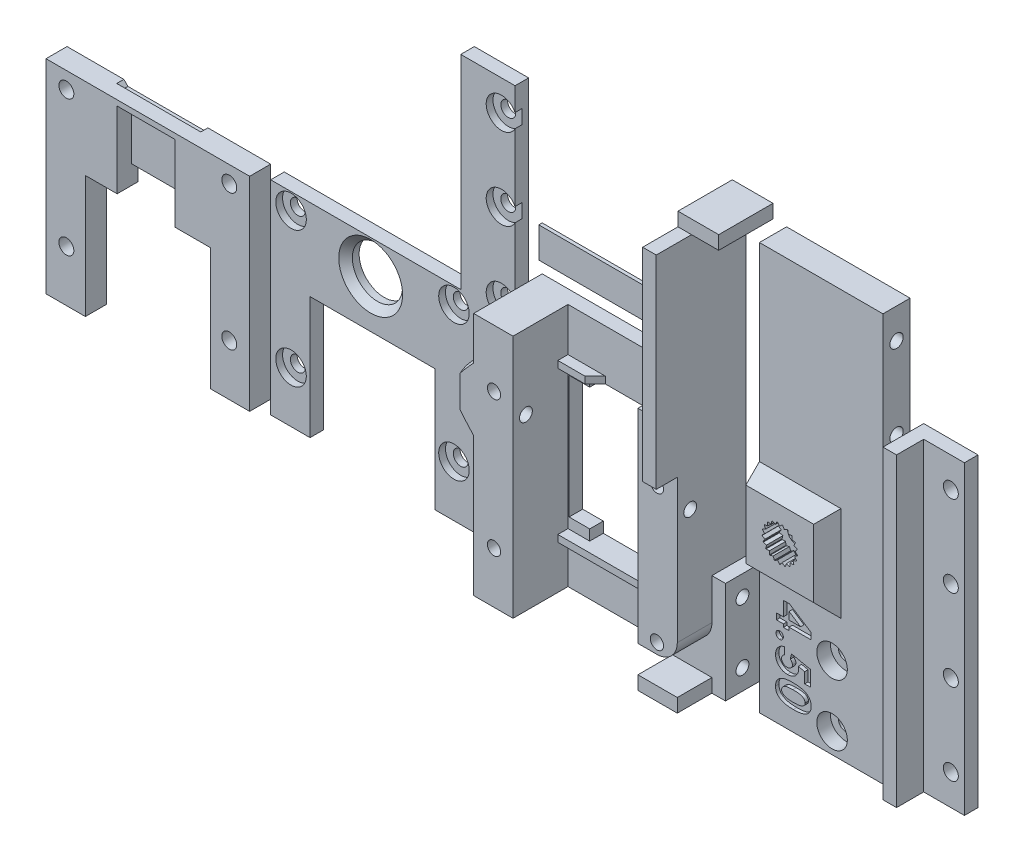
from build123d import *

# Parameters (mm, degrees)
SKETCH2_W                 = 30
SKETCH2_H                 = 36
SKETCH2_W_2               = 18.08
SKETCH2_H_2               = 18.08
BOSS_EXTRUDE1_DEPTH       = 2
SKETCH4_W                 = 5.8
SKETCH4_H                 = 36
BOSS_EXTRUDE2_DEPTH       = 8.1
SKETCH35_W                = 5.8
SKETCH35_H                = 4
CUT_EXTRUDE17_DEPTH       = 5.1
SKETCH14_W                = 12
SKETCH14_H                = 21.2
CUT_EXTRUDE6_DEPTH        = 25.791329129
SKETCH52_W                = 4
SKETCH52_H                = 1
SKETCH52_W_2              = 18.4
BOSS_EXTRUDE27_DEPTH      = 1.5
CHAMFER6_SIZE             = 1.5
SKETCH5_W                 = 30
SKETCH5_H                 = 12
BOSS_EXTRUDE3_DEPTH       = 1
SKETCH6_W                 = 10.48
SKETCH6_H                 = 12
SKETCH6_W_2               = 11.02
BOSS_EXTRUDE4_DEPTH       = 2.1
SKETCH49_W                = 8.5
SKETCH49_H                = 2
CUT_EXTRUDE19_DEPTH       = 1
CHAMFER5_SIZE             = 0.8
SKETCH23_W                = 5.8
SKETCH23_H                = 18
BOSS_EXTRUDE10_DEPTH      = 3.1
SKETCH7_W                 = 8.5
SKETCH7_H                 = 0.8
BOSS_EXTRUDE5_DEPTH       = 2.1
SKETCH10_W                = 11.18
SKETCH10_H                = 0.45
CUT_EXTRUDE2_DEPTH        = 0.6
SKETCH9_W                 = 30
SKETCH9_H                 = 12
SKETCH9_R                 = 3.7
BOSS_EXTRUDE6_DEPTH       = 2
CHAMFER1_SIZE             = 0.6
SKETCH24_W                = 5.8
SKETCH24_H                = 18
BOSS_EXTRUDE11_DEPTH      = 2
SKETCH30_W                = 2
SKETCH30_H                = 15
BOSS_EXTRUDE13_DEPTH      = 5
BOSS_EXTRUDE8_DEPTH       = 13.2
BOSS_EXTRUDE8_DEPTH_BACK  = 5
SKETCH16_W                = 4
SKETCH16_H                = 60
SKETCH32_R                = 0.95
CUT_EXTRUDE14_DEPTH       = 10.8
SKETCH33_R                = 1.05
CUT_EXTRUDE15_DEPTH       = 4
SKETCH34_R                = 2.25
CUT_EXTRUDE16_DEPTH       = 2
SKETCH19_W                = 2
SKETCH19_H                = 60
BOSS_EXTRUDE9_DEPTH       = 6
SKETCH41_W                = 2
SKETCH41_H                = 10.1
BOSS_EXTRUDE17_DEPTH      = 24
SKETCH45_W                = 2
SKETCH45_H                = 30
BOSS_EXTRUDE21_DEPTH      = 2
SKETCH44_W                = 2
SKETCH44_H                = 29.9
BOSS_EXTRUDE20_DEPTH      = 3.1
SKETCH11_R                = 0.975
CUT_EXTRUDE3_DEPTH        = 52.11790293
CUT_EXTRUDE4_START        = -5.1
SKETCH12_R                = 1.1
CUT_EXTRUDE4_DEPTH        = 5.1
SKETCH13_R                = 2.25
CUT_EXTRUDE5_DEPTH        = 1
LPATTERN4_COUNT           = 2
LPATTERN4_PITCH           = 20
LPATTERN4_COPY_1_SKETCH_R = 0.975
LPATTERN4_COPY_1_DEPTH    = 52.11790293
LPATTERN4_START           = -5.1
LPATTERN4_COPY_2_SKETCH_R = 1.1
LPATTERN4_COPY_2_DEPTH    = 5.1
LPATTERN4_COPY_3_SKETCH_R = 2.25
LPATTERN4_COPY_3_DEPTH    = 1
SKETCH42_W                = 8
SKETCH42_H                = 45
BOSS_EXTRUDE18_DEPTH      = 2
SKETCH43_W                = 2
SKETCH43_H                = 45
BOSS_EXTRUDE19_DEPTH      = 4
SKETCH20_R                = 0.975
CUT_EXTRUDE7_DEPTH        = 52.940735459
SKETCH21_R                = 1.1
CUT_EXTRUDE8_DEPTH        = 52.940735459
SKETCH22_R                = 2.25
CUT_EXTRUDE9_DEPTH        = 1
SKETCH50_W                = 6
SKETCH50_H                = 8
BOSS_EXTRUDE25_DEPTH      = 2
LPATTERN6_COUNT           = 5
LPATTERN6_PITCH           = 12
LPATTERN7_COUNT           = 5
LPATTERN7_PITCH           = 12
SKETCH26_W                = 10
SKETCH26_H                = 10
BOSS_EXTRUDE12_DEPTH      = 2
CUT_EXTRUDE11_START       = 2
SKETCH25_R                = 2.625
CUT_EXTRUDE11_DEPTH       = 2.4
BOSS_EXTRUDE28_DEPTH      = 2.4
CIRPATTERN1_COUNT         = 21
SKETCH28_R                = 1.25
CUT_EXTRUDE12_DEPTH       = 3.6
SKETCH29_R                = 3
CUT_EXTRUDE13_DEPTH       = 1.8
SKETCH51_W                = 5.454356058
SKETCH51_H                = 1.75
BOSS_EXTRUDE26_DEPTH      = 0.2
CHAMFER2_SIZE             = 1
FILLET1_R                 = 3
SKETCH37_W                = 2
SKETCH37_H                = 6
BOSS_EXTRUDE14_DEPTH      = 10.1
SKETCH53_OUTSIDE_W        = 39.61
SKETCH53_OUTSIDE_H        = 79.41
SKETCH53_OUTSIDE_R        = 3
CUT_EXTRUDE20_DEPTH       = 2
SKETCH36_R                = 0.95
CUT_EXTRUDE18_DEPTH       = 62.376216892
CHAMFER4_SIZE             = 2
BOSS_EXTRUDE15_START      = 3.25
SKETCH38_W                = 18.08
SKETCH38_H                = 4.5
BOSS_EXTRUDE15_DEPTH      = 0.5
CHAMFER3_SIZE             = 2
CUT_EXTRUDE21_START       = 4
CUT_EXTRUDE21_DEPTH       = 0.5
BODY_MOVE_COPY3_ANGLE     = 90


with BuildPart() as part:
    # Sketch2 → Boss-Extrude1 (new body)
    with BuildSketch(Plane.XY):
        Rectangle(SKETCH2_W, SKETCH2_H)
        Rectangle(SKETCH2_W_2, SKETCH2_H_2, mode=Mode.SUBTRACT)
    extrude(amount=BOSS_EXTRUDE1_DEPTH)

    # Sketch4 → Boss-Extrude2 (add)
    with BuildSketch(Plane.XY.offset(2)):
        with Locations((-12.1, 0)):
            Rectangle(SKETCH4_W, SKETCH4_H)
        with Locations((12.1, 0)):
            Rectangle(SKETCH4_W, SKETCH4_H)
    extrude(amount=BOSS_EXTRUDE2_DEPTH)

    # Sketch35 → Cut-Extrude17 (cut)
    with BuildSketch(Plane.XY.offset(10.1)):
        with Locations((12.1, -14)):
            Rectangle(SKETCH35_W, SKETCH35_H)
    extrude(amount=-CUT_EXTRUDE17_DEPTH, mode=Mode.SUBTRACT)

    # Sketch14 → Cut-Extrude6 (cut, through all)
    with BuildSketch(Plane.XY.offset(2)):
        Rectangle(SKETCH14_W, SKETCH14_H)
    extrude(amount=-CUT_EXTRUDE6_DEPTH, mode=Mode.SUBTRACT)

    # Sketch52 → Boss-Extrude27 (add)
    with BuildSketch(Plane.XY.offset(2)):
        with Locations((-7.2, 11.1)):
            Rectangle(SKETCH52_W, SKETCH52_H)
        with Locations((7.2, 11.1)):
            Rectangle(SKETCH52_W, SKETCH52_H)
        with Locations((0, -11.1)):
            Rectangle(SKETCH52_W_2, SKETCH52_H)
    extrude(amount=BOSS_EXTRUDE27_DEPTH)

    # Chamfer6
    chamfer6_edges = [part.edges().sort_by_distance(p)[0] for p in [
        (5.2, 11.1, 2),
        (-5.2, 11.1, 2),
    ]]
    chamfer(chamfer6_edges, length=CHAMFER6_SIZE - 0.0001)  # a hair under: the kernel refuses the full size

    # Sketch30 → Boss-Extrude13 (add)
    with BuildSketch(Plane.XY):
        with Locations((16, -10.5)):
            Rectangle(SKETCH30_W, SKETCH30_H)
    extrude(amount=BOSS_EXTRUDE13_DEPTH)


with BuildPart() as body_2:
    # Sketch5 → Boss-Extrude3 (new body)
    with BuildSketch(Plane.XY.offset(10.1)):
        with Locations((0, 6)):
            Rectangle(SKETCH5_W, SKETCH5_H)
    extrude(amount=BOSS_EXTRUDE3_DEPTH)

    # Sketch6 → Boss-Extrude4 (add)
    with BuildSketch(Plane.XY.offset(11.1)):
        with Locations((-9.76, 6)):
            Rectangle(SKETCH6_W, SKETCH6_H)
        with Locations((9.49, 6)):
            Rectangle(SKETCH6_W_2, SKETCH6_H)
    extrude(amount=BOSS_EXTRUDE4_DEPTH)

    # Sketch49 → Cut-Extrude19 (cut)
    with BuildSketch(Plane.XY.offset(11.1)):
        with Locations((-0.27, 1)):
            Rectangle(SKETCH49_W, SKETCH49_H)
    extrude(amount=-CUT_EXTRUDE19_DEPTH, mode=Mode.SUBTRACT)

    # Chamfer5
    chamfer5_edges = [body_2.edges().sort_by_distance(p)[0] for p in [
        (-0.27, 2, 11.1),
    ]]
    chamfer(chamfer5_edges, length=CHAMFER5_SIZE)

    # Sketch23 → Boss-Extrude10 (add)
    with BuildSketch(Plane.XY.offset(10.1)):
        with Locations((-12.1, -9)):
            Rectangle(SKETCH23_W, SKETCH23_H)
        with Locations((12.1, -9)):
            Rectangle(SKETCH23_W, SKETCH23_H)
    extrude(amount=BOSS_EXTRUDE10_DEPTH)

    # Sketch7 → Boss-Extrude5 (add)
    with BuildSketch(Plane.XY.offset(11.1)):
        with Locations((-0.27, 11.6)):
            Rectangle(SKETCH7_W, SKETCH7_H)
    extrude(amount=BOSS_EXTRUDE5_DEPTH)

    # Sketch10 → Cut-Extrude2 (cut)
    with BuildSketch(Plane(origin=(0, 12, 0), x_dir=(1, 0, 0), z_dir=(0, 1, 0))):
        with Locations((-0.44, -10.325)):
            Rectangle(SKETCH10_W, SKETCH10_H)
    extrude(amount=-CUT_EXTRUDE2_DEPTH, mode=Mode.SUBTRACT)

    # Chamfer1
    chamfer1_edges = [body_2.edges().sort_by_distance(p)[0] for p in [
        (-0.44, 12, 10.55),
        (5.15, 12, 10.325),
        (-6.03, 12, 10.325),
    ]]
    chamfer(chamfer1_edges, length=CHAMFER1_SIZE - 0.0001)  # a hair under: the kernel refuses the full size


with BuildPart() as body_3:
    # Sketch9 → Boss-Extrude6 (new body)
    with BuildSketch(Plane.XY.offset(13.2)):
        with Locations((0, 6)):
            Rectangle(SKETCH9_W, SKETCH9_H)
        with Locations((-0.27, 7.05)):
            Circle(SKETCH9_R, mode=Mode.SUBTRACT)
    extrude(amount=BOSS_EXTRUDE6_DEPTH)

    # Sketch24 → Boss-Extrude11 (add)
    with BuildSketch(Plane.XY.offset(13.2)):
        with Locations((-12.1, -9)):
            Rectangle(SKETCH24_W, SKETCH24_H)
        with Locations((12.1, -9)):
            Rectangle(SKETCH24_W, SKETCH24_H)
    extrude(amount=BOSS_EXTRUDE11_DEPTH)

    # Sketch19 → Boss-Extrude9 (add)
    with BuildSketch(Plane(origin=(15, 0, 0), x_dir=(0, 0, -1), z_dir=(1, 0, 0))):
        with Locations((-14.2, 12)):
            Rectangle(SKETCH19_W, SKETCH19_H)
    extrude(amount=BOSS_EXTRUDE9_DEPTH)

    # Sketch45 → Boss-Extrude21 (add)
    with BuildSketch(Plane.ZY.offset(-15)):
        with Locations((14.2, 27)):
            Rectangle(SKETCH45_W, SKETCH45_H)
    extrude(amount=BOSS_EXTRUDE21_DEPTH)


with BuildPart() as body_4:
    # Sketch16 → Boss-Extrude8 (new, two sides: drawn at the far end of the back side and taken through both)
    with BuildSketch(Plane.XY.offset(-BOSS_EXTRUDE8_DEPTH_BACK)):
        with Locations((19, 12)):
            Rectangle(SKETCH16_W, SKETCH16_H)
    extrude(amount=BOSS_EXTRUDE8_DEPTH + BOSS_EXTRUDE8_DEPTH_BACK)


with BuildPart() as cut_extrude14_tool:
    # Sketch32 → Cut-Extrude14 (new body)
    with BuildSketch(Plane(origin=(21, 0, 0), x_dir=(0, 0, -1), z_dir=(1, 0, 0))):
        with Locations((-2.5, -15)):
            Circle(SKETCH32_R)
        with Locations((-2.5, -6)):
            Circle(SKETCH32_R)
    extrude(amount=-CUT_EXTRUDE14_DEPTH)


with BuildPart() as part_1:
    add(part.part)

    # Cut-Extrude14: cut by cut_extrude14_tool
    add(cut_extrude14_tool.part, mode=Mode.SUBTRACT)

    # Sketch41 → Boss-Extrude17 (add)
    with BuildSketch(Plane(origin=(0, 18, 0), x_dir=(1, 0, 0), z_dir=(0, 1, 0))):
        with Locations((14, -5.05)):
            Rectangle(SKETCH41_W, SKETCH41_H)
    extrude(amount=BOSS_EXTRUDE17_DEPTH)

    # Sketch44 → Boss-Extrude20 (add)
    with BuildSketch(Plane.XY.offset(10.1)):
        with Locations((14, 27.05)):
            Rectangle(SKETCH44_W, SKETCH44_H)
    extrude(amount=BOSS_EXTRUDE20_DEPTH)


with BuildPart() as body_4_1:
    add(body_4.part)

    # Cut-Extrude14: cut by cut_extrude14_tool
    add(cut_extrude14_tool.part, mode=Mode.SUBTRACT)

    # Sketch33 → Cut-Extrude15 (cut)
    with BuildSketch(Plane(origin=(21, 0, 0), x_dir=(0, 0, -1), z_dir=(1, 0, 0))):
        with Locations((-2.5, -6)):
            Circle(SKETCH33_R)
        with Locations((-2.5, -15)):
            Circle(SKETCH33_R)
    extrude(amount=-CUT_EXTRUDE15_DEPTH, mode=Mode.SUBTRACT)

    # Sketch34 → Cut-Extrude16 (cut)
    with BuildSketch(Plane(origin=(21, 0, 0), x_dir=(0, 0, -1), z_dir=(1, 0, 0))):
        with Locations((-2.5, -6)):
            Circle(SKETCH34_R)
        with Locations((-2.5, -15)):
            Circle(SKETCH34_R)
    extrude(amount=-CUT_EXTRUDE16_DEPTH, mode=Mode.SUBTRACT)


with BuildPart() as cut_extrude3_tool:
    # Sketch11 → Cut-Extrude3 (new, through all)
    with BuildSketch(Plane.XY.offset(15.2)):
        with Locations((-12, 9.55)):
            Circle(SKETCH11_R)
    cut_extrude3 = extrude(amount=-CUT_EXTRUDE3_DEPTH)


with BuildPart() as part_2:
    add(part_1.part)

    # Cut-Extrude3: cut by cut_extrude3_tool
    add(cut_extrude3_tool.part, mode=Mode.SUBTRACT)


with BuildPart() as body_2_1:
    add(body_2.part)

    # Cut-Extrude3: cut by cut_extrude3_tool
    add(cut_extrude3_tool.part, mode=Mode.SUBTRACT)


with BuildPart() as body_3_1:
    add(body_3.part)

    # Cut-Extrude3: cut by cut_extrude3_tool
    add(cut_extrude3_tool.part, mode=Mode.SUBTRACT)


with BuildPart() as cut_extrude4_tool:
    # Sketch12 → Cut-Extrude4 (new body)
    with BuildSketch(Plane.XY.offset(15.2).offset(CUT_EXTRUDE4_START)):
        with Locations((-12, 9.55)):
            Circle(SKETCH12_R)
    cut_extrude4 = extrude(amount=CUT_EXTRUDE4_DEPTH)


with BuildPart() as body_2_2:
    add(body_2_1.part)

    # Cut-Extrude4: cut by cut_extrude4_tool
    add(cut_extrude4_tool.part, mode=Mode.SUBTRACT)


with BuildPart() as body_3_2:
    add(body_3_1.part)

    # Cut-Extrude4: cut by cut_extrude4_tool
    add(cut_extrude4_tool.part, mode=Mode.SUBTRACT)

    # Sketch13 → Cut-Extrude5 (cut)
    with BuildSketch(Plane.XY.offset(15.2)):
        with Locations((-12, 9.55)):
            Circle(SKETCH13_R)
    cut_extrude5 = extrude(amount=-CUT_EXTRUDE5_DEPTH, mode=Mode.SUBTRACT)


with BuildPart() as mirror1_tool:
    # Mirror1: Cut-Extrude3, Cut-Extrude4, Cut-Extrude5 across plane
    add(cut_extrude3.mirror(Plane(origin=(0, 0, 0), x_dir=(0, 0, 1), z_dir=(1, 0, 0))))
    add(cut_extrude4.mirror(Plane(origin=(0, 0, 0), x_dir=(0, 0, 1), z_dir=(1, 0, 0))))
    add(cut_extrude5.mirror(Plane(origin=(0, 0, 0), x_dir=(0, 0, 1), z_dir=(1, 0, 0))))


with BuildPart() as part_3:
    add(part_2.part)

    # Mirror1: cut by mirror1_tool
    add(mirror1_tool.part, mode=Mode.SUBTRACT)


with BuildPart() as body_2_3:
    add(body_2_2.part)

    # Mirror1: cut by mirror1_tool
    add(mirror1_tool.part, mode=Mode.SUBTRACT)


with BuildPart() as body_3_3:
    add(body_3_2.part)

    # Mirror1: cut by mirror1_tool
    add(mirror1_tool.part, mode=Mode.SUBTRACT)


with BuildPart() as lpattern4_tool:
    # LPattern4: Cut-Extrude3, Cut-Extrude4, Cut-Extrude5 ×2
    with Locations(*[(0, -i * LPATTERN4_PITCH, 0) for i in range(1, LPATTERN4_COUNT)]):
        add(cut_extrude3)
        add(cut_extrude4)
        add(cut_extrude5)


with BuildPart() as part_4:
    add(part_3.part)

    # LPattern4: cut by lpattern4_tool
    add(lpattern4_tool.part, mode=Mode.SUBTRACT)


with BuildPart() as body_2_4:
    add(body_2_3.part)

    # LPattern4: cut by lpattern4_tool
    add(lpattern4_tool.part, mode=Mode.SUBTRACT)


with BuildPart() as body_3_4:
    add(body_3_3.part)

    # LPattern4: cut by lpattern4_tool
    add(lpattern4_tool.part, mode=Mode.SUBTRACT)


with BuildPart() as lpattern4_copy_1_tool:
    # LPattern4 copy 1 sketch → LPattern4 copy 1 (new, through all)
    with BuildSketch(Plane(origin=(0, -20, 15.2), x_dir=(-1, 0, 0), z_dir=(0, 0, 1))):
        with Locations((-12, -9.55)):
            Circle(LPATTERN4_COPY_1_SKETCH_R)
    extrude(amount=-LPATTERN4_COPY_1_DEPTH)


with BuildPart() as part_5:
    add(part_4.part)

    # LPattern4 copy 1: cut by lpattern4_copy_1_tool
    add(lpattern4_copy_1_tool.part, mode=Mode.SUBTRACT)

    # Sketch50 → Boss-Extrude25 (add)
    with BuildSketch(Plane(origin=(0, 42, 0), x_dir=(1, 0, 0), z_dir=(0, 1, 0))):
        with Locations((16, -4)):
            Rectangle(SKETCH50_W, SKETCH50_H)
    extrude(amount=BOSS_EXTRUDE25_DEPTH)

    # Fillet1
    fillet1_edges = [part_5.edges().sort_by_distance(p)[0] for p in [
        (15, -12, 7.55),
    ]]
    fillet(fillet1_edges, radius=FILLET1_R)

    # Sketch37 → Boss-Extrude14 (add)
    with BuildSketch(Plane.XY):
        with Locations((-16, 7.05)):
            Rectangle(SKETCH37_W, SKETCH37_H)
    extrude(amount=BOSS_EXTRUDE14_DEPTH)

    # Sketch53 outside → Cut-Extrude20 (cut)
    with BuildSketch(Plane.ZY.offset(17)):
        with Locations((4.1, 13)):
            Rectangle(SKETCH53_OUTSIDE_W, SKETCH53_OUTSIDE_H)
        with Locations((8.2, 7.05)):
            Circle(SKETCH53_OUTSIDE_R, mode=Mode.SUBTRACT)
    extrude(amount=-CUT_EXTRUDE20_DEPTH, mode=Mode.SUBTRACT)

    # Sketch36 → Cut-Extrude18 (cut, through all)
    with BuildSketch(Plane.ZY.offset(17)):
        with Locations((8.2, 7.05)):
            Circle(SKETCH36_R)
    extrude(amount=-CUT_EXTRUDE18_DEPTH, mode=Mode.SUBTRACT)

    # Chamfer4
    chamfer4_edges = [part_5.edges().sort_by_distance(p)[0] for p in [
        (-15, 7.05, 5.2),
    ]]
    chamfer(chamfer4_edges, length=CHAMFER4_SIZE - 0.0001)  # a hair under: the kernel refuses the full size


with BuildPart() as body_2_5:
    add(body_2_4.part)

    # LPattern4 copy 1: cut by lpattern4_copy_1_tool
    add(lpattern4_copy_1_tool.part, mode=Mode.SUBTRACT)


with BuildPart() as body_3_5:
    add(body_3_4.part)

    # LPattern4 copy 1: cut by lpattern4_copy_1_tool
    add(lpattern4_copy_1_tool.part, mode=Mode.SUBTRACT)


with BuildPart() as lpattern4_copy_2_tool:
    # LPattern4 copy 2 sketch → LPattern4 copy 2 (new body)
    with BuildSketch(Plane(origin=(0, -20, 15.2), x_dir=(-1, 0, 0), z_dir=(0, 0, 1)).offset(LPATTERN4_START)):
        with Locations((-12, -9.55)):
            Circle(LPATTERN4_COPY_2_SKETCH_R)
    extrude(amount=LPATTERN4_COPY_2_DEPTH)


with BuildPart() as body_2_6:
    add(body_2_5.part)

    # LPattern4 copy 2: cut by lpattern4_copy_2_tool
    add(lpattern4_copy_2_tool.part, mode=Mode.SUBTRACT)


with BuildPart() as body_3_6:
    add(body_3_5.part)

    # LPattern4 copy 2: cut by lpattern4_copy_2_tool
    add(lpattern4_copy_2_tool.part, mode=Mode.SUBTRACT)

    # LPattern4 copy 3 sketch → LPattern4 copy 3 (cut)
    with BuildSketch(Plane(origin=(0, -20, 15.2), x_dir=(-1, 0, 0), z_dir=(0, 0, 1))):
        with Locations((-12, -9.55)):
            Circle(LPATTERN4_COPY_3_SKETCH_R)
    extrude(amount=-LPATTERN4_COPY_3_DEPTH, mode=Mode.SUBTRACT)


with BuildPart() as body_5:
    # Sketch42 → Boss-Extrude18 (new body)
    with BuildSketch(Plane(origin=(0, 0, -5), x_dir=(-1, 0, 0), z_dir=(0, 0, -1))):
        with Locations((-17, 19.5)):
            Rectangle(SKETCH42_W, SKETCH42_H)
    extrude(amount=BOSS_EXTRUDE18_DEPTH)

    # Sketch43 → Boss-Extrude19 (add)
    with BuildSketch(Plane.XY.offset(-5)):
        with Locations((14, 19.5)):
            Rectangle(SKETCH43_W, SKETCH43_H)
    extrude(amount=BOSS_EXTRUDE19_DEPTH)


with BuildPart() as cut_extrude7_tool:
    # Sketch20 → Cut-Extrude7 (new, through all)
    with BuildSketch(Plane.XY.offset(15.2)):
        with Locations((19, -10.45)):
            Circle(SKETCH20_R)
    cut_extrude7 = extrude(amount=-CUT_EXTRUDE7_DEPTH)


with BuildPart() as body_3_7:
    add(body_3_6.part)

    # Cut-Extrude7: cut by cut_extrude7_tool
    add(cut_extrude7_tool.part, mode=Mode.SUBTRACT)

    # Sketch21 → Cut-Extrude8 (cut, through all)
    with BuildSketch(Plane.XY.offset(15.2)):
        with Locations((19, -10.45)):
            Circle(SKETCH21_R)
    cut_extrude8 = extrude(amount=-CUT_EXTRUDE8_DEPTH, mode=Mode.SUBTRACT)

    # Sketch22 → Cut-Extrude9 (cut)
    with BuildSketch(Plane.XY.offset(15.2)):
        with Locations((19, -10.45)):
            Circle(SKETCH22_R)
    cut_extrude9 = extrude(amount=-CUT_EXTRUDE9_DEPTH, mode=Mode.SUBTRACT)


with BuildPart() as body_4_2:
    add(body_4_1.part)

    # Cut-Extrude7: cut by cut_extrude7_tool
    add(cut_extrude7_tool.part, mode=Mode.SUBTRACT)

    # LPattern7: Cut-Extrude7 ×5
    with Locations(*[(0, i * LPATTERN7_PITCH, 0) for i in range(1, LPATTERN7_COUNT)]):
        add(cut_extrude7, mode=Mode.SUBTRACT)

    # Sketch26 → Boss-Extrude12 (add)
    with BuildSketch(Plane(origin=(21, 0, 0), x_dir=(0, 0, -1), z_dir=(1, 0, 0))):
        with Locations((-8.2, 7.05)):
            Rectangle(SKETCH26_W, SKETCH26_H)
    extrude(amount=BOSS_EXTRUDE12_DEPTH)

    # Sketch25 → Cut-Extrude11 (cut)
    with BuildSketch(Plane(origin=(21, 0, 0), x_dir=(0, 0, -1), z_dir=(1, 0, 0)).offset(CUT_EXTRUDE11_START)):
        with Locations(Location((-8.2, 7.05, 0), (0, 0, 180))):
            Circle(SKETCH25_R)
    extrude(amount=-CUT_EXTRUDE11_DEPTH, mode=Mode.SUBTRACT)

    # Sketch54 → Boss-Extrude28 (add)
    with BuildSketch(Plane(origin=(20.6, 0, 0), x_dir=(0, 0, -1), z_dir=(1, 0, 0))):
        with BuildLine():
            Line((-8.557226017, 9.650579661), (-8.2, 9.3))
            Line((-8.2, 9.3), (-7.842773983, 9.650579661))
            ThreePointArc((-7.842773983, 9.650579661), (-8.2, 9.675), (-8.557226017, 9.650579661))
        make_face()
    boss_extrude28 = extrude(amount=BOSS_EXTRUDE28_DEPTH)

    # CirPattern1: Boss-Extrude28 ×21 about axis
    cirpattern1_axis = Axis((0, 7.05, 8.2), (1, 0, 0))
    for i in range(1, CIRPATTERN1_COUNT):
        add(boss_extrude28.rotate(cirpattern1_axis, i * 360 / CIRPATTERN1_COUNT))

    # Sketch28 → Cut-Extrude12 (cut)
    with BuildSketch(Plane(origin=(20.6, 0, 0), x_dir=(0, 0, -1), z_dir=(1, 0, 0))):
        with Locations((-8.2, 7.05)):
            Circle(SKETCH28_R)
    extrude(amount=-CUT_EXTRUDE12_DEPTH, mode=Mode.SUBTRACT)

    # Sketch29 → Cut-Extrude13 (cut)
    with BuildSketch(Plane.ZY.offset(-17)):
        with Locations((8.2, 7.05)):
            Circle(SKETCH29_R)
    extrude(amount=-CUT_EXTRUDE13_DEPTH, mode=Mode.SUBTRACT)

    # Sketch51 → Boss-Extrude26 (add)
    with BuildSketch(Plane.ZY.offset(-18.8)):
        with Locations((8.2, 9.175)):
            Rectangle(SKETCH51_W, SKETCH51_H)
        with Locations((8.2, 4.925)):
            Rectangle(SKETCH51_W, SKETCH51_H)
    extrude(amount=BOSS_EXTRUDE26_DEPTH)

    # Chamfer3
    chamfer3_edges = [body_4_2.edges().sort_by_distance(p)[0] for p in [
        (21, 2.05, 8.2),
        (21, 7.05, 3.2),
        (21, 12.05, 8.2),
    ]]
    chamfer(chamfer3_edges, length=CHAMFER3_SIZE - 0.0001)  # a hair under: the kernel refuses the full size

    # Sketch55 → Cut-Extrude21 (cut)
    # profile 1 of 4: a face of its own
    with BuildSketch(Plane(origin=(17, 0, 0), x_dir=(0, 0, -1), z_dir=(1, 0, 0)).offset(CUT_EXTRUDE21_START)):
        Polygon((-5.571794872, -3.95724701), (-5.571794872, -4.891742203), (-8.841025641, -4.891742203), (-8.841025641, -5.340460151), (-9.674358974, -5.340460151), (-9.674358974, -4.891742203), (-10.7, -4.891742203), (-10.7, -3.994306305), (-9.674358974, -3.994306305), (-9.674358974, -1.87892169), (-8.765905449, -1.87892169), align=None)
        Polygon((-8.841025641, -3.994306305), (-7.139302885, -3.994306305), (-8.841025641, -2.887535472), align=None, mode=Mode.SUBTRACT)
    # profile 2 of 4: a face of its own
    with BuildSketch(Plane(origin=(17, 0, 0), x_dir=(0, 0, -1), z_dir=(1, 0, 0)).offset(CUT_EXTRUDE21_START)):
        with BuildLine():
            add(Edge.make_bspline(
                [(-9.674358974, -6.590460151), (-9.676329917, -6.626697208), (-9.680210363, -6.698041713), (-9.709697668, -6.801260898), (-9.761532612, -6.894959635), (-9.830354456, -6.978146655), (-9.912259564, -7.048779735), (-10.006694634, -7.098171994), (-10.10901466, -7.130121393), (-10.180592671, -7.133567941), (-10.217227564, -7.135331946)],
                knots=[0, 0, 0, 0, 1.016476041, 2.001265769, 2.982571086, 4.001334304, 5.018889842, 5.99575474, 6.974191785, 8, 8, 8, 8], degree=3))
            add(Edge.make_bspline(
                [(-10.217227564, -7.135331946), (-10.253868111, -7.133579503), (-10.325457167, -7.130155543), (-10.427981349, -7.097953595), (-10.523182635, -7.048858419), (-10.605971266, -6.978140757), (-10.676084573, -6.895305821), (-10.727429716, -6.801045849), (-10.758575853, -6.698237939), (-10.762242603, -6.626731722), (-10.764102564, -6.590460151)],
                knots=[0, 0, 0, 0, 1.022731703, 1.998234309, 2.980426153, 4.002090265, 5.023754376, 6.00211665, 6.986572482, 8, 8, 8, 8], degree=3))
            add(Edge.make_bspline(
                [(-10.764102564, -6.590460151), (-10.762227354, -6.554197173), (-10.758530543, -6.482707895), (-10.727689674, -6.380059544), (-10.675737722, -6.286490373), (-10.60605579, -6.203676244), (-10.522888131, -6.133273113), (-10.428279855, -6.082741269), (-10.325418386, -6.050836505), (-10.253854982, -6.047365089), (-10.217227564, -6.045588356)],
                knots=[0, 0, 0, 0, 1.013910294, 1.9988351, 2.969460266, 3.991611077, 5.013761889, 6.000813773, 6.976781088, 8, 8, 8, 8], degree=3))
            add(Edge.make_bspline(
                [(-10.217227564, -6.045588356), (-10.180606028, -6.047376805), (-10.109054115, -6.050871112), (-10.00639269, -6.082522246), (-9.912555668, -6.133349064), (-9.830269756, -6.203670602), (-9.761876755, -6.286834785), (-9.709441271, -6.379845696), (-9.680256008, -6.48290422), (-9.676345292, -6.554231728), (-9.674358974, -6.590460151)],
                knots=[0, 0, 0, 0, 1.02629359, 2.005193596, 2.986963232, 4.00500024, 5.0242455, 5.997787305, 6.983042999, 8, 8, 8, 8], degree=3))
        make_face()
    # profile 3 of 4: a face of its own
    with BuildSketch(Plane(origin=(17, 0, 0), x_dir=(0, 0, -1), z_dir=(1, 0, 0)).offset(CUT_EXTRUDE21_START)):
        with BuildLine():
            Line((-5.7, -8.704843164), (-5.7, -10.981485792))
            Line((-5.7, -10.981485792), (-6.533333333, -10.981485792))
            Line((-6.533333333, -10.981485792), (-6.533333333, -9.415980985))
            Line((-6.533333333, -9.415980985), (-7.478846154, -9.220668485))
            add(Edge.make_bspline(
                [(-7.478846154, -9.220668485), (-7.471411762, -9.247278786), (-7.456661288, -9.300075919), (-7.442360098, -9.379211443), (-7.432582382, -9.455802592), (-7.431364197, -9.505762883), (-7.430769231, -9.530163677)],
                knots=[0, 0, 0, 0, 1.054652254, 2.092520994, 3.068380062, 4, 4, 4, 4], degree=3))
            add(Edge.make_bspline(
                [(-7.430769231, -9.530163677), (-7.431987503, -9.583329874), (-7.434388987, -9.68813216), (-7.4571869, -9.841444606), (-7.493092922, -9.988250329), (-7.544302318, -10.128100089), (-7.610952669, -10.26085727), (-7.69158091, -10.386682801), (-7.786328655, -10.505731112), (-7.895255222, -10.615887402), (-8.014859058, -10.717103603), (-8.144223263, -10.805105317), (-8.281503229, -10.880264272), (-8.427552284, -10.940043107), (-8.581453143, -10.987225659), (-8.743304429, -11.021320826), (-8.913297961, -11.041483001), (-9.029272394, -11.044201746), (-9.088421474, -11.045588356)],
                knots=[0, 0, 0, 0, 1.01440847, 1.999622559, 2.951875003, 3.895578053, 4.836219714, 5.782137149, 6.743708247, 7.735272588, 8.734977101, 9.730283169, 10.717124674, 11.717316708, 12.737475749, 13.78628267, 14.87096371, 16, 16, 16, 16], degree=3))
            add(Edge.make_bspline(
                [(-9.088421474, -11.045588356), (-9.148245672, -11.04390395), (-9.2662963, -11.040580125), (-9.43980969, -11.018621435), (-9.606341796, -10.980622199), (-9.764963387, -10.925801832), (-9.917026523, -10.857994917), (-10.061501713, -10.77376762), (-10.198807929, -10.674575354), (-10.327069218, -10.560646528), (-10.44432167, -10.436842246), (-10.547463941, -10.305006521), (-10.634258558, -10.16608154), (-10.704402971, -10.020059811), (-10.759900064, -9.867780187), (-10.800299277, -9.709196161), (-10.823465986, -9.543537114), (-10.826608055, -9.431076142), (-10.828205128, -9.373913677)],
                knots=[0, 0, 0, 0, 1.06812338, 2.107719657, 3.117068656, 4.112431602, 5.099639003, 6.085279307, 7.092884053, 8.119131772, 9.143854758, 10.133578715, 11.102895672, 12.062725997, 13.020721913, 13.992309192, 14.979516593, 16, 16, 16, 16], degree=3))
            add(Edge.make_bspline(
                [(-10.828205128, -9.373913677), (-10.826898623, -9.322794986), (-10.824321921, -9.22197823), (-10.808484153, -9.073479575), (-10.780482831, -8.93031038), (-10.739957668, -8.793230719), (-10.690080444, -8.660798284), (-10.627699549, -8.534544032), (-10.5540028, -8.413774173), (-10.470335163, -8.298831649), (-10.376086816, -8.191584113), (-10.272915762, -8.093699925), (-10.162122421, -8.004586484), (-10.042339941, -7.926150677), (-9.913745292, -7.858638377), (-9.777853994, -7.798767091), (-9.633246906, -7.749761845), (-9.532997239, -7.724893093), (-9.482051282, -7.712255023)],
                knots=[0, 0, 0, 0, 1.054957082, 2.080596141, 3.077793124, 4.061112343, 5.027190972, 5.994718051, 6.962465889, 7.943658696, 8.924948258, 9.904494768, 10.875059, 11.855380583, 12.854004648, 13.869083016, 14.917087635, 16, 16, 16, 16], degree=3))
            Line((-9.482051282, -7.712255023), (-9.482051282, -8.737896049))
            add(Edge.make_bspline(
                [(-9.482051282, -8.737896049), (-9.517358924, -8.756641608), (-9.585975297, -8.793071464), (-9.67700562, -8.862424752), (-9.755078289, -8.940043188), (-9.819473181, -9.02603153), (-9.86825582, -9.119167585), (-9.905591012, -9.21633101), (-9.926721576, -9.319252381), (-9.929411099, -9.389514877), (-9.930769231, -9.424995408)],
                knots=[0, 0, 0, 0, 1.105084364, 2.147605349, 3.154024051, 4.144789344, 5.108147638, 6.055727127, 7.018198351, 8, 8, 8, 8], degree=3))
            add(Edge.make_bspline(
                [(-9.930769231, -9.424995408), (-9.929838405, -9.449727086), (-9.928006989, -9.498387081), (-9.91832571, -9.570083245), (-9.899965765, -9.638507415), (-9.874621644, -9.704229963), (-9.842595038, -9.767445935), (-9.803244849, -9.827836895), (-9.756818638, -9.885100171), (-9.704068256, -9.939044936), (-9.645110554, -9.987735322), (-9.582173127, -10.030804758), (-9.515310804, -10.067648034), (-9.443786431, -10.096286253), (-9.368395092, -10.119396441), (-9.28904188, -10.136516122), (-9.205544403, -10.146722915), (-9.148546502, -10.147669562), (-9.119471154, -10.148152459)],
                knots=[0, 0, 0, 0, 0.978584799, 1.925382083, 2.854237347, 3.773848163, 4.706917643, 5.651871472, 6.619075428, 7.618203006, 8.630937754, 9.638147826, 10.630884984, 11.643619732, 12.679505692, 13.746568031, 14.850495961, 16, 16, 16, 16], degree=3))
            add(Edge.make_bspline(
                [(-9.119471154, -10.148152459), (-9.091049031, -10.147747231), (-9.035685273, -10.146957883), (-8.95483442, -10.135791812), (-8.8774351, -10.121799844), (-8.804211528, -10.099181348), (-8.73434578, -10.07158512), (-8.669457963, -10.035508104), (-8.606574216, -9.99634626), (-8.550257553, -9.948652763), (-8.498155738, -9.898242193), (-8.452667898, -9.843934072), (-8.414896441, -9.786396522), (-8.381926141, -9.727371704), (-8.357929874, -9.664515515), (-8.341404837, -9.599238242), (-8.329279343, -9.531609359), (-8.32856693, -9.485481136), (-8.328205128, -9.462054703)],
                knots=[0, 0, 0, 0, 1.166407123, 2.272056916, 3.347877023, 4.393466184, 5.414668253, 6.42708463, 7.438943561, 8.452102724, 9.450960385, 10.414941083, 11.35441816, 12.274885341, 13.186627518, 14.108013686, 15.039145946, 16, 16, 16, 16], degree=3))
            add(Edge.make_bspline(
                [(-8.328205128, -9.462054703), (-8.329170683, -9.436608154), (-8.331105863, -9.385607813), (-8.346851903, -9.30983407), (-8.372334902, -9.234973948), (-8.407492738, -9.160611147), (-8.453503251, -9.087483847), (-8.507468309, -9.013662183), (-8.573308983, -8.941617124), (-8.622347267, -8.895808872), (-8.647716346, -8.872110792)],
                knots=[0, 0, 0, 0, 0.88288272, 1.769486374, 2.674910571, 3.623812639, 4.617874466, 5.670434592, 6.794841017, 8, 8, 8, 8], degree=3))
            Line((-8.647716346, -8.872110792), (-8.474439103, -8.116902459))
            Line((-8.474439103, -8.116902459), (-5.7, -8.704843164))
        make_face()
    # profile 4 of 4: a face of its own
    with BuildSketch(Plane(origin=(17, 0, 0), x_dir=(0, 0, -1), z_dir=(1, 0, 0)).offset(CUT_EXTRUDE21_START)):
        with BuildLine():
            add(Edge.make_bspline(
                [(-5.571794872, -13.370307908), (-5.572439663, -13.413747575), (-5.573707494, -13.499161566), (-5.587442071, -13.624959531), (-5.608185115, -13.746140696), (-5.637135942, -13.863165414), (-5.675374062, -13.975241189), (-5.721535869, -14.083271711), (-5.77672506, -14.186348471), (-5.840141144, -14.284709908), (-5.911064679, -14.378814121), (-5.993045811, -14.46553045), (-6.082453118, -14.548215378), (-6.180762419, -14.625497859), (-6.288643799, -14.696512637), (-6.404668086, -14.762585355), (-6.529927399, -14.822863971), (-6.664549401, -14.878145911), (-6.810574525, -14.927600957), (-6.969694051, -14.969139268), (-7.141793919, -15.005251469), (-7.327770713, -15.033690842), (-7.527185734, -15.056967796), (-7.740412134, -15.072176701), (-7.966853206, -15.082757062), (-8.122195501, -15.08361112), (-8.202003205, -15.084049895)],
                knots=[0, 0, 0, 0, 0.879087513, 1.728520926, 2.558587148, 3.366762743, 4.166157112, 4.95337177, 5.74258602, 6.530032775, 7.320866164, 8.124307838, 8.942260106, 9.784645725, 10.652593514, 11.554662219, 12.485739241, 13.464770064, 14.499274465, 15.604285219, 16.792026686, 18.057713884, 19.411711354, 20.855437135, 22.384468668, 24, 24, 24, 24], degree=3))
            add(Edge.make_bspline(
                [(-8.202003205, -15.084049895), (-8.282808898, -15.083572375), (-8.439812911, -15.082644562), (-8.668331916, -15.072647967), (-8.883082878, -15.055433494), (-9.08404328, -15.033245814), (-9.271108007, -15.002856224), (-9.444758018, -14.967261047), (-9.604941898, -14.924978523), (-9.751259929, -14.873877447), (-9.886201131, -14.819067282), (-10.010779763, -14.758199306), (-10.127233934, -14.694936081), (-10.233940751, -14.625442666), (-10.331134802, -14.551195978), (-10.419709014, -14.473361616), (-10.498443768, -14.390281035), (-10.568964995, -14.303196708), (-10.630694295, -14.209992524), (-10.683728202, -14.111078458), (-10.727555744, -14.005787072), (-10.765332381, -13.895650096), (-10.792510842, -13.778708211), (-10.814058298, -13.65676704), (-10.825970602, -13.528464691), (-10.827448062, -13.441110708), (-10.828205128, -13.396349574)],
                knots=[0, 0, 0, 0, 1.643682949, 3.193646483, 4.651618242, 6.025629174, 7.305184366, 8.505292942, 9.630500342, 10.672179876, 11.655924581, 12.591484594, 13.491256898, 14.350247848, 15.17884557, 15.977481787, 16.746098769, 17.504475725, 18.254166354, 19.016819136, 19.783753977, 20.571954997, 21.382401421, 22.223156612, 23.089526058, 24, 24, 24, 24], degree=3))
            add(Edge.make_bspline(
                [(-10.828205128, -13.396349574), (-10.8274302, -13.351590529), (-10.825912126, -13.263908216), (-10.814182999, -13.135246556), (-10.792237828, -13.012383801), (-10.765504851, -12.894353605), (-10.727352045, -12.782192534), (-10.682820987, -12.675081188), (-10.629484173, -12.573552817), (-10.568028746, -12.477543461), (-10.497541535, -12.387400791), (-10.418793256, -12.301718673), (-10.331978952, -12.220688092), (-10.236127495, -12.145541283), (-10.132517927, -12.075047851), (-10.019967284, -12.009942188), (-9.898638979, -11.950266251), (-9.768365609, -11.894142084), (-9.626335598, -11.845412855), (-9.471309186, -11.80189826), (-9.301823124, -11.766849859), (-9.118514268, -11.736150548), (-8.92074023, -11.715537898), (-8.709413317, -11.69790895), (-8.483881408, -11.688045414), (-8.328881626, -11.687100497), (-8.249078526, -11.686613997)],
                knots=[0, 0, 0, 0, 0.917197984, 1.796777363, 2.643741708, 3.473481078, 4.273990801, 5.068160217, 5.848535553, 6.620952589, 7.401027954, 8.190319769, 9.003592045, 9.831693788, 10.683727512, 11.569696396, 12.49373307, 13.453184301, 14.474457586, 15.568383184, 16.750575061, 18.019320986, 19.375517054, 20.823796471, 22.364701649, 24, 24, 24, 24], degree=3))
            add(Edge.make_bspline(
                [(-8.249078526, -11.686613997), (-8.138198701, -11.687484652), (-7.924254652, -11.689164593), (-7.615124106, -11.709908193), (-7.329598227, -11.741287616), (-7.067332019, -11.784243636), (-6.82883882, -11.842100713), (-6.614187136, -11.913103876), (-6.421252191, -11.994575248), (-6.306937853, -12.063888936), (-6.251883013, -12.097271049)],
                knots=[0, 0, 0, 0, 1.288526675, 2.486228817, 3.599112392, 4.626206381, 5.5730174, 6.447949553, 7.252518174, 8, 8, 8, 8], degree=3))
            add(Edge.make_bspline(
                [(-6.251883013, -12.097271049), (-6.197798654, -12.136093937), (-6.092053074, -12.212000334), (-5.953228895, -12.344724791), (-5.834499658, -12.487319939), (-5.738552314, -12.642714602), (-5.662888231, -12.808451149), (-5.609447541, -12.985952511), (-5.578310505, -13.174563206), (-5.573999182, -13.304085317), (-5.571794872, -13.370307908)],
                knots=[0, 0, 0, 0, 1.058512271, 2.069600068, 3.047294572, 4.004278952, 4.967380941, 5.939006123, 6.946246673, 8, 8, 8, 8], degree=3))
        make_face()
        with BuildLine():
            add(Edge.make_bspline(
                [(-6.469230769, -13.392343164), (-6.471106348, -13.353080621), (-6.474783477, -13.276105194), (-6.505474175, -13.164580135), (-6.553908869, -13.059887808), (-6.610999391, -12.979746572), (-6.66669803, -12.920032058), (-6.715556036, -12.876753191), (-6.772699362, -12.837992548), (-6.835658023, -12.800593861), (-6.906164686, -12.767319052), (-6.982441, -12.734232297), (-7.067033468, -12.707276118), (-7.158347816, -12.6807284), (-7.258958416, -12.657518846), (-7.369656509, -12.637927241), (-7.491274485, -12.621032927), (-7.623517531, -12.606767673), (-7.766912163, -12.597698132), (-7.921124523, -12.58892115), (-8.086473755, -12.585726001), (-8.200334324, -12.584620442), (-8.259094551, -12.584049895)],
                knots=[0, 0, 0, 0, 1.076821401, 2.111141558, 3.153197101, 4.23200803, 4.796476379, 5.394298193, 6.020090776, 6.690078086, 7.403703365, 8.159894791, 8.971856079, 9.83973388, 10.771758647, 11.806038152, 12.926526118, 14.143777411, 15.458313878, 16.872423957, 18.385946227, 20, 20, 20, 20], degree=3))
            add(Edge.make_bspline(
                [(-8.259094551, -12.584049895), (-8.335223245, -12.584963717), (-8.481205658, -12.586716038), (-8.691125782, -12.595929156), (-8.882196844, -12.614289608), (-9.055596895, -12.637424121), (-9.210667978, -12.668939384), (-9.347458232, -12.70818042), (-9.466980392, -12.751696363), (-9.567476753, -12.806257114), (-9.653421769, -12.86471418), (-9.727768505, -12.927107882), (-9.789700239, -12.994526431), (-9.842279046, -13.064954652), (-9.881321887, -13.141004324), (-9.909785375, -13.221116022), (-9.927140237, -13.305467583), (-9.929552573, -13.363217234), (-9.930769231, -13.392343164)],
                knots=[0, 0, 0, 0, 1.772047989, 3.398033405, 4.888860297, 6.238411839, 7.468309579, 8.567754056, 9.549141588, 10.421774021, 11.221426488, 11.965694757, 12.675067502, 13.348095901, 14.005005053, 14.656328889, 15.322321954, 16, 16, 16, 16], degree=3))
            add(Edge.make_bspline(
                [(-9.930769231, -13.392343164), (-9.929937691, -13.420470669), (-9.928309638, -13.475540826), (-9.911597902, -13.555845448), (-9.884428247, -13.631787205), (-9.845994864, -13.703136805), (-9.797120937, -13.770149455), (-9.737591692, -13.832497639), (-9.666813763, -13.88971114), (-9.614286072, -13.923043985), (-9.587219551, -13.940219767)],
                knots=[0, 0, 0, 0, 0.992283464, 1.942767638, 2.88273346, 3.832339453, 4.79467288, 5.803907806, 6.868395428, 8, 8, 8, 8], degree=3))
            add(Edge.make_bspline(
                [(-9.587219551, -13.940219767), (-9.550235252, -13.960447601), (-9.472682176, -14.00286373), (-9.341788228, -14.051823271), (-9.194347422, -14.09358951), (-9.02916761, -14.127070463), (-8.84691157, -14.153589625), (-8.647443844, -14.173863529), (-8.430478518, -14.184161327), (-8.280137446, -14.185775231), (-8.202003205, -14.186613997)],
                knots=[0, 0, 0, 0, 0.710996797, 1.490902623, 2.352723643, 3.296875318, 4.334065587, 5.461510359, 6.680713396, 8, 8, 8, 8], degree=3))
            add(Edge.make_bspline(
                [(-8.202003205, -14.186613997), (-8.123193145, -14.186284218), (-7.971497234, -14.185649449), (-7.753719916, -14.174003263), (-7.554816449, -14.157785083), (-7.375231036, -14.134062487), (-7.214527297, -14.103539303), (-7.072717086, -14.065918585), (-6.949516667, -14.02156898), (-6.845062264, -13.968968008), (-6.756258925, -13.910733186), (-6.680177773, -13.84883584), (-6.614677837, -13.783168932), (-6.561587356, -13.713024933), (-6.51927289, -13.638871947), (-6.490436478, -13.560309887), (-6.472697286, -13.477600099), (-6.470401871, -13.421145726), (-6.469230769, -13.392343164)],
                knots=[0, 0, 0, 0, 1.793903324, 3.452957663, 4.963427329, 6.336122014, 7.574844885, 8.684777121, 9.673127442, 10.55010789, 11.340650774, 12.086136756, 12.779466299, 13.446812155, 14.083183996, 14.715685896, 15.34475337, 16, 16, 16, 16], degree=3))
        make_face(mode=Mode.SUBTRACT)
    extrude(amount=-CUT_EXTRUDE21_DEPTH, mode=Mode.SUBTRACT)


with BuildPart() as lpattern6_tool:
    # LPattern6: Cut-Extrude8, Cut-Extrude9 ×5
    with Locations(*[(0, i * LPATTERN6_PITCH, 0) for i in range(1, LPATTERN6_COUNT)]):
        add(cut_extrude8)
        add(cut_extrude9)


with BuildPart() as body_3_8:
    add(body_3_7.part)

    # LPattern6: cut by lpattern6_tool
    add(lpattern6_tool.part, mode=Mode.SUBTRACT)

    # Chamfer2
    chamfer2_edges = [body_3_8.edges().sort_by_distance(p)[0] for p in [
        (-3.97, 7.05, 15.2),
    ]]
    chamfer(chamfer2_edges, length=CHAMFER2_SIZE)


with BuildPart() as body_5_1:
    add(body_5.part)

    # LPattern6: cut by lpattern6_tool
    add(lpattern6_tool.part, mode=Mode.SUBTRACT)


with BuildPart() as body_6:
    # Sketch38 → Boss-Extrude15 (new body)
    with BuildSketch(Plane.XY.offset(2).offset(BOSS_EXTRUDE15_START)):
        with Locations((0, -4.5)):
            Rectangle(SKETCH38_W, SKETCH38_H)
    extrude(amount=BOSS_EXTRUDE15_DEPTH)


with BuildPart() as body_3_9:
    # Body-Move/Copy1: read off the stored shape, not the designer's step
    # Body-Move/Copy1: moved
    add(body_3_8.part.moved(Location((-38, 0, -13.2))))


with BuildPart() as body_2_7:
    # Body-Move/Copy2: read off the stored shape, not the designer's step
    # Body-Move/Copy2: moved
    add(body_2_6.part.moved(Location((-70, 0, -10.1))))


with BuildPart() as body_4_3:
    # Body-Move/Copy3: read off the stored shape, not the designer's step
    # Body-Move/Copy3: moved
    add(body_4_2.part.moved(Location((-17, 0, -34.2))).rotate(Axis((0, 0, 0), (0, -1, 0)), BODY_MOVE_COPY3_ANGLE))


with BuildPart() as body_5_2:
    # Body-Move/Copy4: read off the stored shape, not the designer's step
    # Body-Move/Copy4: moved
    add(body_5_1.part.moved(Location((28.2, -15, 7))))


with BuildPart() as body_6_1:
    # Body-Move/Copy5: read off the stored shape, not the designer's step
    # Body-Move/Copy5: moved
    add(body_6.part.moved(Location((-5.96, 26.75, -5.25))))


solid = Compound([part_5.part, body_3_9.part, body_2_7.part, body_4_3.part, body_5_2.part, body_6_1.part])
